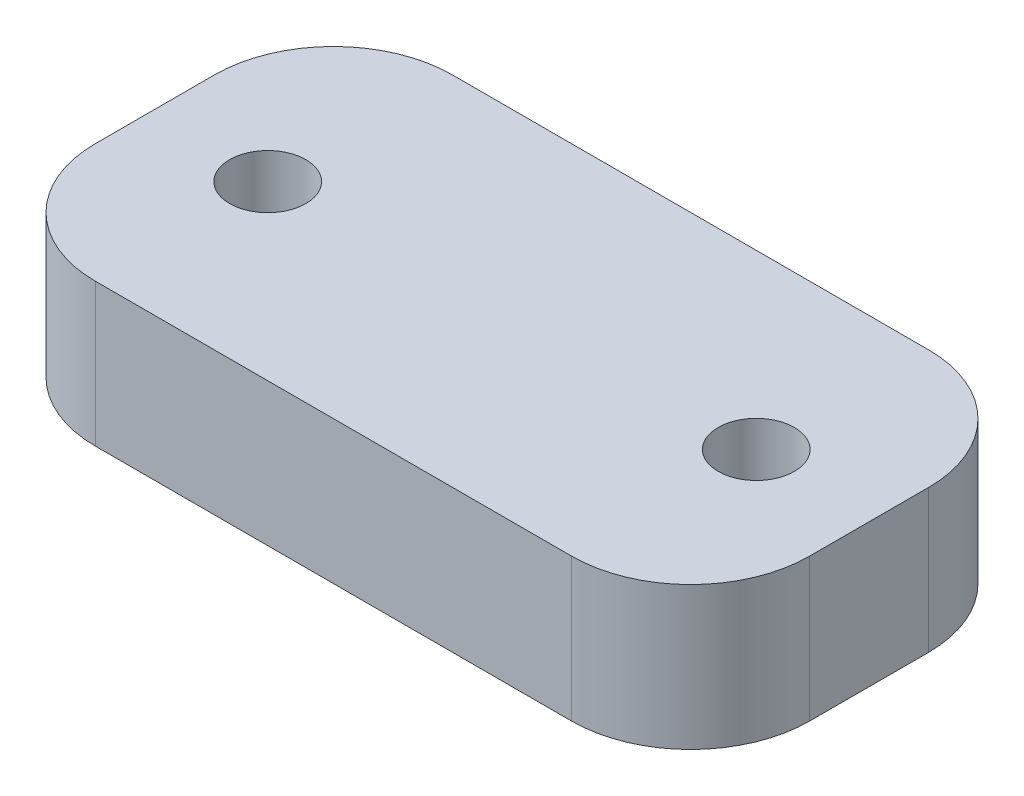
from build123d import *

# Parameters (mm, degrees)
SKETCH1_W            = 30
SKETCH1_H            = 15
BOSS_EXTRUDE1_DEPTH  = 6
M3_CLEARANCE_HOLE1_D = 3.2
FILLET1_R            = 5


with BuildPart() as part:
    # Sketch1 → Boss-Extrude1 (new body)
    with BuildSketch(Plane(origin=(0, 0, 0), x_dir=(1, 0, 0), z_dir=(0, 1, 0))):
        Rectangle(SKETCH1_W, SKETCH1_H)
    extrude(amount=BOSS_EXTRUDE1_DEPTH)

    # M3 Clearance Hole1 (through all)
    with Locations(Plane(origin=(0, 6, 0), x_dir=(1, 0, 0), z_dir=(0, 1, 0))):
        with Locations((-10, -0.25906141), (10, 0.25906141)):
            Hole(M3_CLEARANCE_HOLE1_D / 2)

    # Fillet1
    fillet1_edges = [part.edges().sort_by_distance(p)[0] for p in [
        (15, 3, 7.5),
        (-15, 3, -7.5),
        (15, 3, -7.5),
        (-15, 3, 7.5),
    ]]
    fillet(fillet1_edges, radius=FILLET1_R)


solid = part.part
